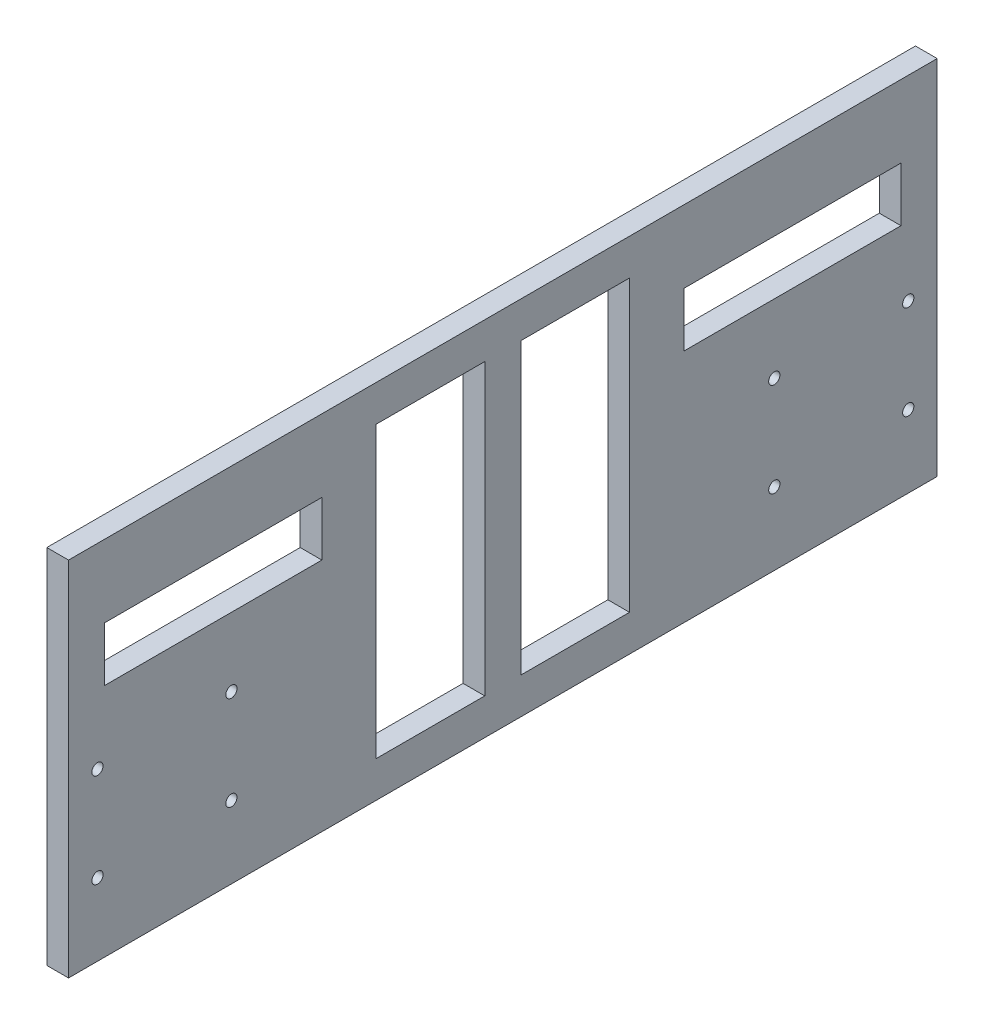
from build123d import *

# Parameters (mm, degrees)
SKETCH_1_W          = 240
SKETCH_1_H          = 100
EXTRUDE_1_DEPTH     = 6
SKETCH_2_R          = 1.55
CUT_EXTRUDE_1_DEPTH = 261.069221555
SKETCH_3_W          = 60
SKETCH_3_H          = 15
CUT_EXTRUDE_2_DEPTH = 261.069221555
SKETCH_4_W          = 30
SKETCH_4_H          = 80
CUT_EXTRUDE_3_DEPTH = 261.069221555


with BuildPart() as part:
    # 草图1 → 凸台-拉伸1 (new body)
    with BuildSketch(Plane(origin=(0, 0, 0), x_dir=(0, 0, -1), z_dir=(1, 0, 0))):
        with Locations((120, -50)):
            Rectangle(SKETCH_1_W, SKETCH_1_H)
    extrude(amount=EXTRUDE_1_DEPTH)

    # 草图2 → 切除-拉伸1 (cut, through all)
    with BuildSketch(Plane(origin=(6, 0, 0), x_dir=(0, 0, -1), z_dir=(1, 0, 0))):
        with Locations((8, -54)):
            Circle(SKETCH_2_R)
        with Locations((45, -80)):
            Circle(SKETCH_2_R)
        with Locations((45, -54)):
            Circle(SKETCH_2_R)
        with Locations((8, -80)):
            Circle(SKETCH_2_R)
        with Locations((232, -80)):
            Circle(SKETCH_2_R)
        with Locations((195, -54)):
            Circle(SKETCH_2_R)
        with Locations((195, -80)):
            Circle(SKETCH_2_R)
        with Locations((232, -54)):
            Circle(SKETCH_2_R)
    extrude(amount=-CUT_EXTRUDE_1_DEPTH, mode=Mode.SUBTRACT)

    # 草图3 → 切除-拉伸2 (cut, through all)
    with BuildSketch(Plane(origin=(6, 0, 0), x_dir=(0, 0, -1), z_dir=(1, 0, 0))):
        with Locations((40, -27.5)):
            Rectangle(SKETCH_3_W, SKETCH_3_H)
        with Locations((200, -27.5)):
            Rectangle(SKETCH_3_W, SKETCH_3_H)
    extrude(amount=-CUT_EXTRUDE_2_DEPTH, mode=Mode.SUBTRACT)

    # 草图4 → 切除-拉伸3 (cut, through all)
    with BuildSketch(Plane(origin=(6, 0, 0), x_dir=(0, 0, -1), z_dir=(1, 0, 0))):
        with Locations((100, -50)):
            Rectangle(SKETCH_4_W, SKETCH_4_H)
        with Locations((140, -50)):
            Rectangle(SKETCH_4_W, SKETCH_4_H)
    extrude(amount=-CUT_EXTRUDE_3_DEPTH, mode=Mode.SUBTRACT)


solid = part.part
